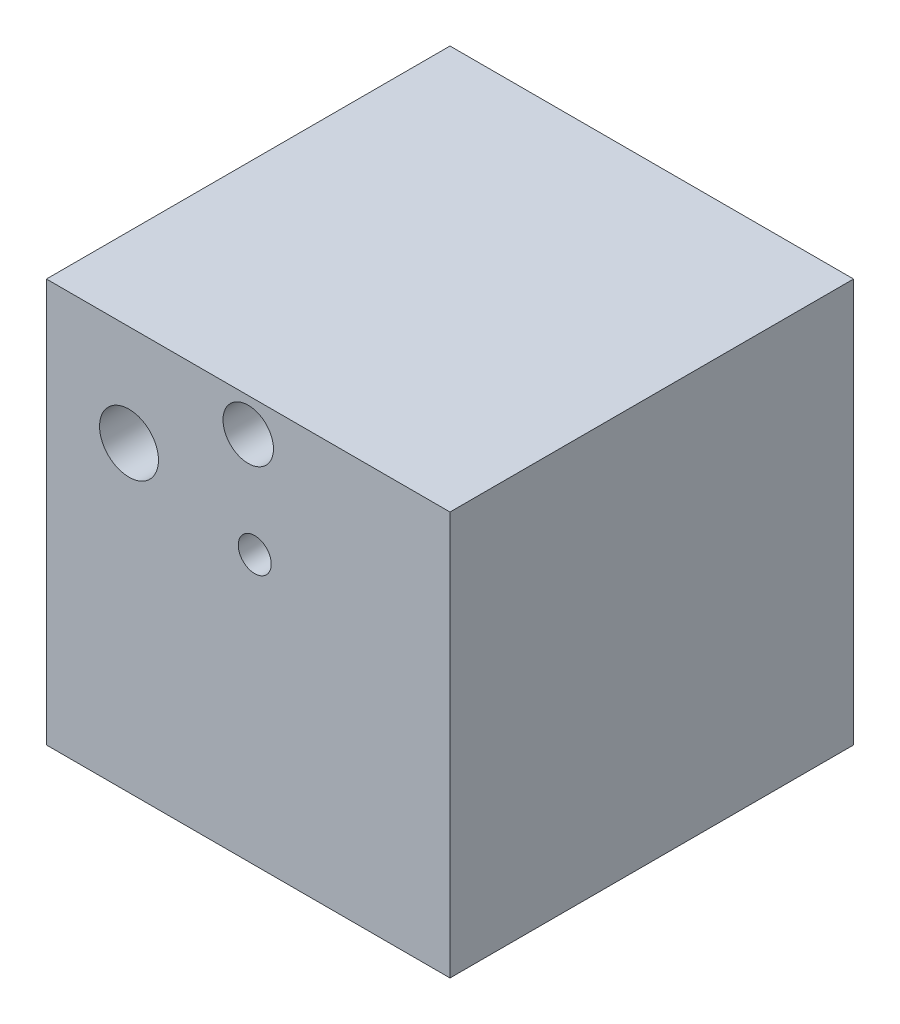
from build123d import *

# Parameters (mm, degrees)
SKETCH2_W           = 76.2
SKETCH2_H           = 76.2
BOSS_EXTRUDE1_DEPTH = 76.2
SKETCH3_R           = 4.7625
SKETCH3_R_2         = 5.5626
SKETCH3_R_3         = 3.115332474
CUT_EXTRUDE1_DEPTH  = 63.5


with BuildPart() as part:
    # Sketch2 → Boss-Extrude1 (new body)
    with BuildSketch(Plane(origin=(0, 0, 0), x_dir=(1, 0, 0), z_dir=(0, 1, 0))):
        Rectangle(SKETCH2_W, SKETCH2_H)
    extrude(amount=BOSS_EXTRUDE1_DEPTH)

    # Sketch3 → Cut-Extrude1 (cut)
    with BuildSketch(Plane.XY.offset(38.1)):
        with Locations((0, 69.85)):
            Circle(SKETCH3_R)
        with Locations((-22.508846711, 57.15)):
            Circle(SKETCH3_R_2)
        with Locations((1.231067995, 50.8)):
            Circle(SKETCH3_R_3)
    extrude(amount=-CUT_EXTRUDE1_DEPTH, mode=Mode.SUBTRACT)


solid = part.part
